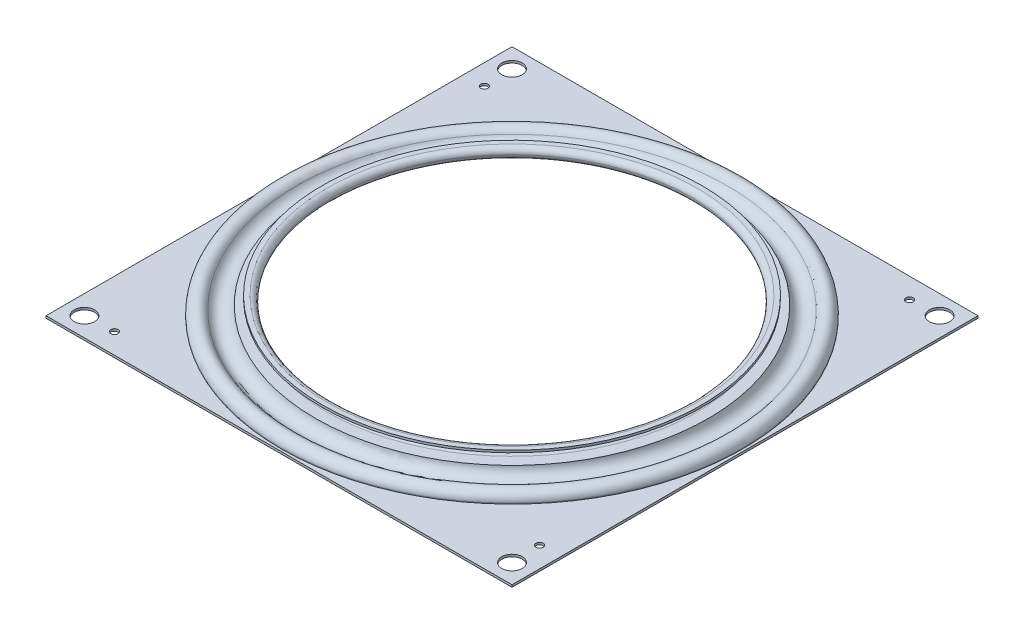
from build123d import *

# Parameters (mm, degrees)
SKETCH2_W                                 = 154.0002
SKETCH2_H                                 = 154.0002
SKETCH2_R                                 = 75.529340861
EXTRUDE1_DEPTH                            = 0.7366
EXTRUDE2_START                            = -0.7366
SKETCH3_R                                 = 75.529340861
EXTRUDE2_DEPTH                            = 0.7366
CIRPATTERN1_COUNT                         = 6
SKETCH5_W                                 = 3.3782
SKETCH5_H                                 = 0.7366
F_5_32_0_156250_DIAMETER_HOLE1_AT_2_COUNT = 2
F_5_32_0_156250_DIAMETER_HOLE1_AT_2_PITCH = 141.3002
F_5_32_0_156250_DIAMETER_HOLE1_AT_3_COUNT = 2
F_5_32_0_156250_DIAMETER_HOLE1_AT_3_PITCH = 141.3002
F_5_32_0_156250_DIAMETER_HOLE1_AT_4_COUNT = 2
F_5_32_0_156250_DIAMETER_HOLE1_AT_4_PITCH = 199.828659206
SKETCH7_W                                 = 2.3876
SKETCH7_H                                 = 8.128
F_5_32_0_156250_DIAMETER_HOLE2_AT_2_COUNT = 2
F_5_32_0_156250_DIAMETER_HOLE2_AT_2_PITCH = 121.0564
F_5_32_0_156250_DIAMETER_HOLE2_AT_3_COUNT = 2
F_5_32_0_156250_DIAMETER_HOLE2_AT_3_PITCH = 171.199602692
F_5_32_0_156250_DIAMETER_HOLE2_AT_4_COUNT = 2
F_5_32_0_156250_DIAMETER_HOLE2_AT_4_PITCH = 121.0564
CIRPATTERN2_COUNT                         = 4


# Read off the part's stored shape, not the designer's step: Revolve-Thin5
with BuildPart() as part:
    # Sketch1 → Revolve-Thin4 (revolve)
    with BuildSketch(Plane.XY, mode=Mode.PRIVATE) as revolve_thin4_sk:
        with BuildLine():
            Line((62.74854946, 1.778), (61.214, 1.778))
            ThreePointArc((61.214, 1.778), (59.436, 0), (61.214, -1.778))
            Line((61.214, -1.778), (64.28309892, -1.778))
            ThreePointArc((64.28309892, -1.778), (67.669225582, -4.788771381), (71.737577241, -2.794))
            ThreePointArc((71.737577241, -2.794), (74.023261161, -1.847238721), (75.529340861, -3.81))
            Line((75.529340861, -3.81), (75.529340861, -4.826))
            Line((75.529340861, -4.826), (77.0001, -4.826))
            Line((77.0001, -4.826), (77.0001, -4.0894))
            Line((77.0001, -4.0894), (76.265940861, -4.0894))
            Line((76.265940861, -4.0894), (76.265940861, -3.81))
            ThreePointArc((76.265940861, -3.81), (74.21390727, -1.135737757), (71.099662929, -2.4257))
            ThreePointArc((71.099662929, -2.4257), (67.492675346, -4.00937161), (64.902401285, -1.0414))
            Line((64.902401285, -1.0414), (61.214, -1.0414))
            ThreePointArc((61.214, -1.0414), (60.1726, 0), (61.214, 1.0414))
            Line((61.214, 1.0414), (62.74854946, 1.0414))
            Line((62.74854946, 1.0414), (62.74854946, 1.778))
        make_face()
    revolve(revolve_thin4_sk.sketch.rotate(Axis((0, 21.71272626, 0), (0, -1, 0)), 90), axis=Axis((0, 21.71272626, 0), (0, -1, 0)))

    # Sketch2 → Extrude1 (add)
    with BuildSketch(Plane.XZ.offset(4.826)):
        Rectangle(SKETCH2_W, SKETCH2_H)
        with Locations(Location((0, 0, 0), (0, 0, 90))):
            Circle(SKETCH2_R, mode=Mode.SUBTRACT)
    extrude(amount=-EXTRUDE1_DEPTH)

    # Sketch5 → 5/32 (0.156250) Diameter Hole1 (revolve, cut)
    with BuildSketch(Plane(origin=(70.6501, -4.0894, -70.6501), x_dir=(0, 0, 1), z_dir=(1, 0, 0))):
        with Locations((1.6891, 0.3683)):
            Rectangle(SKETCH5_W, SKETCH5_H)
    f_5_32_0_156250_diameter_hole1 = revolve(axis=Axis((70.6501, 2.2606, -70.6501), (0, -1, 0)), mode=Mode.SUBTRACT)

    # 5/32 (0.156250) Diameter Hole1 at 2: 5/32 (0.156250) Diameter Hole1 ×2
    with Locations(*[(0, 0, i * F_5_32_0_156250_DIAMETER_HOLE1_AT_2_PITCH) for i in range(1, F_5_32_0_156250_DIAMETER_HOLE1_AT_2_COUNT)]):
        add(f_5_32_0_156250_diameter_hole1, mode=Mode.SUBTRACT)

    # 5/32 (0.156250) Diameter Hole1 at 3: 5/32 (0.156250) Diameter Hole1 ×2
    with Locations(*[(-i * F_5_32_0_156250_DIAMETER_HOLE1_AT_3_PITCH, 0, 0) for i in range(1, F_5_32_0_156250_DIAMETER_HOLE1_AT_3_COUNT)]):
        add(f_5_32_0_156250_diameter_hole1, mode=Mode.SUBTRACT)

    # 5/32 (0.156250) Diameter Hole1 at 4: 5/32 (0.156250) Diameter Hole1 ×2
    with Locations(*[Vector(-0.7071067811865476, 0, 0.7071067811865476) * (i * F_5_32_0_156250_DIAMETER_HOLE1_AT_4_PITCH) for i in range(1, F_5_32_0_156250_DIAMETER_HOLE1_AT_4_COUNT)]):
        add(f_5_32_0_156250_diameter_hole1, mode=Mode.SUBTRACT)

    # Sketch11 → 3/32 (0.093750) Diameter Hole2 (revolve, cut)
    with BuildSketch(Plane(origin=(-70.2437, -4.0894, -61.1251), x_dir=(0, 0, 1), z_dir=(1, 0, 0))):
        Polygon((0, 0), (0, 26.115399675), (1.190625, 25.4), (1.190625, 0), align=None)
    f_3_32_0_093750_diameter_hole2 = revolve(axis=Axis((-70.2437, 2.2606, -61.1251), (0, -1, 0)), mode=Mode.SUBTRACT)

    # CirPattern2: 3/32 (0.093750) Diameter Hole2 ×4 about axis
    cirpattern2_axis = Axis((0, 0, 0), (0, 1, 0))
    for i in range(1, CIRPATTERN2_COUNT):
        add(f_3_32_0_093750_diameter_hole2.rotate(cirpattern2_axis, i * 360 / CIRPATTERN2_COUNT), mode=Mode.SUBTRACT)


with BuildPart() as body_2:
    # Revolve-Thin5 outline → Revolve-Thin5 (revolve)
    with BuildSketch(Plane.XY):
        with BuildLine():
            Line((76.265940861, 2.5654), (77.0001, 2.5654))
            Line((77.0001, 2.5654), (77.0001, 3.302))
            Line((77.0001, 3.302), (75.529340861, 3.302))
            Line((75.529340861, 3.302), (75.529340861, 2.286))
            ThreePointArc((75.529340861, 2.286), (74.023261161, 0.323238721), (71.737577241, 1.27))
            ThreePointArc((71.737577241, 1.27), (68.088390068, 3.299931105), (64.576093872, 1.0414))
            Line((64.576093872, 1.0414), (61.214, 1.0414))
            Line((61.214, 1.0414), (61.214, 0.3048))
            Line((61.214, 0.3048), (65.066299927, 0.3048))
            ThreePointArc((65.066299927, 0.3048), (67.890458911, 2.54923464), (71.099662929, 0.9017))
            ThreePointArc((71.099662929, 0.9017), (74.21390727, -0.388262243), (76.265940861, 2.286))
            Line((76.265940861, 2.286), (76.265940861, 2.5654))
        make_face()
    revolve(axis=Axis((0, 0, 0), (0, 1, 0)))

    # Sketch3 → Extrude2 (add)
    with BuildSketch(Plane(origin=(0, 3.302, 0), x_dir=(-1, 0, 0), z_dir=(0, 1, 0)).offset(EXTRUDE2_START)):
        Polygon((0, -108.894585724), (108.894585724, 0), (0, 108.894585724), (-108.894585724, 0), align=None)
        with Locations(Location((0, 0, 0), (0, 0, 90))):
            Circle(SKETCH3_R, mode=Mode.SUBTRACT)
    extrude(amount=EXTRUDE2_DEPTH)

    # Sketch7 → 5/32 (0.156250) Diameter Hole2 (revolve, cut)
    with BuildSketch(Plane(origin=(85.599801346, 3.302, 0), x_dir=(0, 0, 1), z_dir=(1, 0, 0))):
        with Locations((1.1938, 4.064)):
            Rectangle(SKETCH7_W, SKETCH7_H)
    f_5_32_0_156250_diameter_hole2 = revolve(axis=Axis((85.599801346, 9.652, 0), (0, -1, 0)), mode=Mode.SUBTRACT)

    # 5/32 (0.156250) Diameter Hole2 at 2: 5/32 (0.156250) Diameter Hole2 ×2
    with Locations(*[Vector(-0.7071067811865476, 0, -0.7071067811865476) * (i * F_5_32_0_156250_DIAMETER_HOLE2_AT_2_PITCH) for i in range(1, F_5_32_0_156250_DIAMETER_HOLE2_AT_2_COUNT)]):
        add(f_5_32_0_156250_diameter_hole2, mode=Mode.SUBTRACT)

    # 5/32 (0.156250) Diameter Hole2 at 3: 5/32 (0.156250) Diameter Hole2 ×2
    with Locations(*[(-i * F_5_32_0_156250_DIAMETER_HOLE2_AT_3_PITCH, 0, 0) for i in range(1, F_5_32_0_156250_DIAMETER_HOLE2_AT_3_COUNT)]):
        add(f_5_32_0_156250_diameter_hole2, mode=Mode.SUBTRACT)

    # 5/32 (0.156250) Diameter Hole2 at 4: 5/32 (0.156250) Diameter Hole2 ×2
    with Locations(*[Vector(-0.7071067811865476, 0, 0.7071067811865476) * (i * F_5_32_0_156250_DIAMETER_HOLE2_AT_4_PITCH) for i in range(1, F_5_32_0_156250_DIAMETER_HOLE2_AT_4_COUNT)]):
        add(f_5_32_0_156250_diameter_hole2, mode=Mode.SUBTRACT)


with BuildPart() as body_3:
    # Sketch4 → Revolve1 (revolve)
    with BuildSketch(Plane.XY):
        with BuildLine():
            Line((68.21805, 2.5146), (68.21805, -4.0386))
            ThreePointArc((68.21805, -4.0386), (71.49465, -0.762), (68.21805, 2.5146))
        make_face()
    revolve(axis=Axis((68.21805, 2.837450101, 0), (0, -1, 0)))


with BuildPart() as cirpattern1_1:
    # CirPattern1: pattern copy
    add(body_3.part.rotate(Axis((0, 0, 0), (0, 1, 0)), 1 * 360 / CIRPATTERN1_COUNT))


with BuildPart() as cirpattern1_2:
    # CirPattern1: pattern copy
    add(body_3.part.rotate(Axis((0, 0, 0), (0, 1, 0)), 2 * 360 / CIRPATTERN1_COUNT))


with BuildPart() as cirpattern1_3:
    # CirPattern1: pattern copy
    add(body_3.part.rotate(Axis((0, 0, 0), (0, 1, 0)), 3 * 360 / CIRPATTERN1_COUNT))


with BuildPart() as cirpattern1_4:
    # CirPattern1: pattern copy
    add(body_3.part.rotate(Axis((0, 0, 0), (0, 1, 0)), 4 * 360 / CIRPATTERN1_COUNT))


with BuildPart() as cirpattern1_5:
    # CirPattern1: pattern copy
    add(body_3.part.rotate(Axis((0, 0, 0), (0, 1, 0)), 5 * 360 / CIRPATTERN1_COUNT))


solid = part.part
